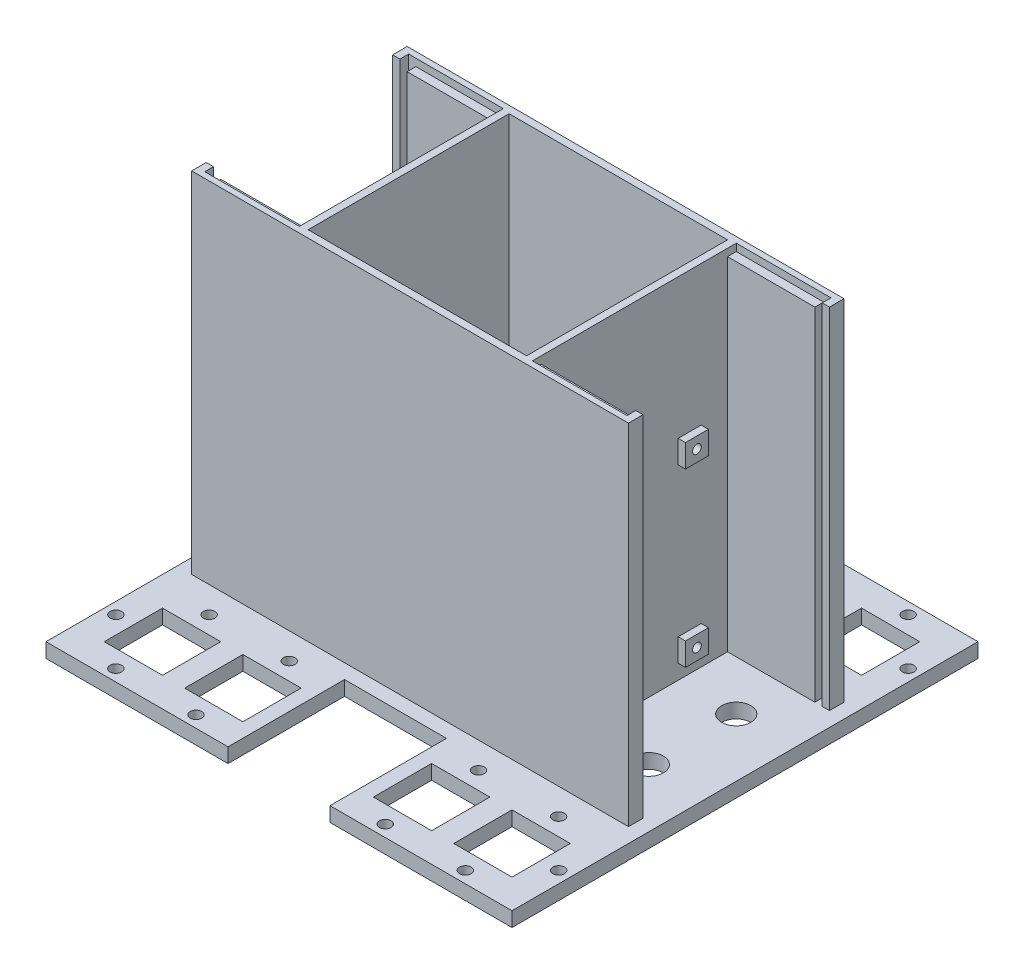
from build123d import *

# Parameters (mm, degrees)
SKETCH1_W               = 203.2
SKETCH1_H               = 203.2
BOSS_EXTRUDE1_DEPTH     = 6.35
SKETCH2_W               = 44.45
SKETCH2_H               = 45.72
SKETCH2_H_2             = 50.8
CUT_EXTRUDE1_DEPTH      = 144.824345992
SKETCH3_R               = 2.54
SKETCH3_W               = 25.4
SKETCH3_H               = 25.4
CUT_EXTRUDE2_DEPTH      = 6.35
MIRROR2_COPY_1_SKETCH_R = 2.54
MIRROR2_COPY_1_SKETCH_W = 25.4
MIRROR2_COPY_1_SKETCH_H = 25.4
MIRROR2_COPY_1_DEPTH    = 6.35
SKETCH4_W               = 101.6
SKETCH4_H               = 93.98
SKETCH4_W_2             = 95.25
SKETCH4_H_2             = 87.63
BOSS_EXTRUDE2_DEPTH     = 152.4
SKETCH5_W               = 10
SKETCH5_H               = 10
SKETCH5_R               = 1.6
BOSS_EXTRUDE3_DEPTH     = 3.175
CUT_EXTRUDE3_REACH      = 246.393
SKETCH8_R               = 1.905
SKETCH9_W               = 6.35
SKETCH9_H               = 152.4
BOSS_EXTRUDE4_DEPTH     = 44.45
SKETCH12_W              = 3.175
SKETCH12_H              = 3.81
CUT_EXTRUDE4_DEPTH      = 152.4
SKETCH13_W              = 38.1
SKETCH13_H              = 3.81
CUT_EXTRUDE5_DEPTH      = 3.175
SKETCH14_W              = 6.35
SKETCH14_H              = 152.4
BOSS_EXTRUDE5_DEPTH     = 44.45
SKETCH15_W              = 3.175
SKETCH15_H              = 3.81
CUT_EXTRUDE6_DEPTH      = 152.4
SKETCH16_W              = 38.1
SKETCH16_H              = 3.81
CUT_EXTRUDE7_DEPTH      = 3.175
CUT_EXTRUDE8_REACH      = 211.454
SKETCH17_R              = 6.35
MIRROR5_OUTLINE_R       = 6.35
MIRROR5_DEPTH           = 6.35


# Read off the part's stored shape, not the designer's step: Mirror5
with BuildPart() as part:
    # Sketch1 → Boss-Extrude1 (new body)
    with BuildSketch(Plane(origin=(0, 0, 0), x_dir=(1, 0, 0), z_dir=(0, 1, 0))):
        Rectangle(SKETCH1_W, SKETCH1_H)
    extrude(amount=BOSS_EXTRUDE1_DEPTH)

    # Sketch2 → Cut-Extrude1 (cut, through all)
    with BuildSketch(Plane(origin=(0, 6.35, 0), x_dir=(1, 0, 0), z_dir=(0, 1, 0))):
        with Locations((0, 78.74)):
            Rectangle(SKETCH2_W, SKETCH2_H)
        with Locations((0, -76.2)):
            Rectangle(SKETCH2_W, SKETCH2_H_2)
    extrude(amount=-CUT_EXTRUDE1_DEPTH, mode=Mode.SUBTRACT)

    # Sketch3 → Cut-Extrude2 (cut)
    with BuildSketch(Plane(origin=(0, 6.35, 0), x_dir=(1, 0, 0), z_dir=(0, 1, 0))):
        with Locations(Location((-96.52, 76.2, 0), (0, 0, 270))):
            Circle(SKETCH3_R)
        with Locations(Location((-76.2, 96.52, 0), (0, 0, 270))):
            Circle(SKETCH3_R)
        with Locations(Location((-76.2, 55.88, 0), (0, 0, 270))):
            Circle(SKETCH3_R)
        with Locations(Location((-41.275, 96.52, 0), (0, 0, 270))):
            Circle(SKETCH3_R)
        with Locations(Location((-41.275, 55.88, 0), (0, 0, 90))):
            Circle(SKETCH3_R)
        with Locations((-41.148, 76.2)):
            Rectangle(SKETCH3_W, SKETCH3_H)
        with Locations((-76.2, 76.2)):
            Rectangle(SKETCH3_W, SKETCH3_H)
    cut_extrude2 = extrude(amount=-CUT_EXTRUDE2_DEPTH, mode=Mode.SUBTRACT)

    # Mirror1: Cut-Extrude2 across plane
    add(cut_extrude2.mirror(Plane(origin=(0, 0, 0), x_dir=(0, 0, 1), z_dir=(1, 0, 0))), mode=Mode.SUBTRACT)

    # Mirror2: Cut-Extrude2 across plane
    add(cut_extrude2.mirror(Plane.XY), mode=Mode.SUBTRACT)

    # Mirror2 copy 1 sketch → Mirror2 copy 1 (cut)
    with BuildSketch(Plane(origin=(0, 6.35, 0), x_dir=(-1, 0, 0), z_dir=(0, 1, 0))):
        with Locations(Location((-96.52, 76.2, 0), (0, 0, 270))):
            Circle(MIRROR2_COPY_1_SKETCH_R)
        with Locations(Location((-76.2, 96.52, 0), (0, 0, 270))):
            Circle(MIRROR2_COPY_1_SKETCH_R)
        with Locations(Location((-76.2, 55.88, 0), (0, 0, 270))):
            Circle(MIRROR2_COPY_1_SKETCH_R)
        with Locations(Location((-41.275, 96.52, 0), (0, 0, 270))):
            Circle(MIRROR2_COPY_1_SKETCH_R)
        with Locations(Location((-41.275, 55.88, 0), (0, 0, 90))):
            Circle(MIRROR2_COPY_1_SKETCH_R)
        with Locations((-41.148, 76.2)):
            Rectangle(MIRROR2_COPY_1_SKETCH_W, MIRROR2_COPY_1_SKETCH_H)
        with Locations((-76.2, 76.2)):
            Rectangle(MIRROR2_COPY_1_SKETCH_W, MIRROR2_COPY_1_SKETCH_H)
    extrude(amount=-MIRROR2_COPY_1_DEPTH, mode=Mode.SUBTRACT)

    # Sketch4 → Boss-Extrude2 (add)
    with BuildSketch(Plane(origin=(0, 6.35, 0), x_dir=(1, 0, 0), z_dir=(0, 1, 0))):
        with Locations((0, 2.54)):
            Rectangle(SKETCH4_W, SKETCH4_H)
        with Locations((0, 2.54)):
            Rectangle(SKETCH4_W_2, SKETCH4_H_2, mode=Mode.SUBTRACT)
    extrude(amount=BOSS_EXTRUDE2_DEPTH)

    # Sketch5 → Boss-Extrude3 (add)
    # profile 1 of 4: a face of its own
    with BuildSketch(Plane(origin=(50.8, 0, 0), x_dir=(0, 0, -1), z_dir=(1, 0, 0))):
        with Locations((-21.59, 93.98)):
            Rectangle(SKETCH5_W, SKETCH5_H)
        with Locations((-21.59, 93.98)):
            Circle(SKETCH5_R, mode=Mode.SUBTRACT)
    # profile 2 of 4: a face of its own
    with BuildSketch(Plane(origin=(50.8, 0, 0), x_dir=(0, 0, -1), z_dir=(1, 0, 0))):
        with Locations((26.67, 92.71)):
            Rectangle(SKETCH5_W, SKETCH5_H)
        with Locations((26.67, 92.71)):
            Circle(SKETCH5_R, mode=Mode.SUBTRACT)
    # profile 3 of 4: a face of its own
    with BuildSketch(Plane(origin=(50.8, 0, 0), x_dir=(0, 0, -1), z_dir=(1, 0, 0))):
        with Locations((-21.59, 11.43)):
            Rectangle(SKETCH5_W, SKETCH5_H)
        with Locations((-21.59, 11.43)):
            Circle(SKETCH5_R, mode=Mode.SUBTRACT)
    # profile 4 of 4: a face of its own
    with BuildSketch(Plane(origin=(50.8, 0, 0), x_dir=(0, 0, -1), z_dir=(1, 0, 0))):
        with Locations((26.67, 17.78)):
            Rectangle(SKETCH5_W, SKETCH5_H)
        with Locations((26.67, 17.78)):
            Circle(SKETCH5_R, mode=Mode.SUBTRACT)
    extrude(amount=BOSS_EXTRUDE3_DEPTH)

    # Sketch8 → Cut-Extrude3 (cut, up to next)
    with BuildSketch(Plane(origin=(53.975, 0, 0), x_dir=(0, 0, -1), z_dir=(1, 0, 0)), mode=Mode.PRIVATE) as cut_extrude3_sk1:
        with Locations((-21.59, 93.98)):
            Circle(SKETCH8_R)
    cut_extrude3_tool1 = extrude(cut_extrude3_sk1.sketch, amount=-CUT_EXTRUDE3_REACH, mode=Mode.PRIVATE) & part.part
    # Sketch8 → Cut-Extrude3 (cut, up to next)
    with BuildSketch(Plane(origin=(53.975, 0, 0), x_dir=(0, 0, -1), z_dir=(1, 0, 0)), mode=Mode.PRIVATE) as cut_extrude3_sk2:
        with Locations((26.67, 92.71)):
            Circle(SKETCH8_R)
    cut_extrude3_tool2 = extrude(cut_extrude3_sk2.sketch, amount=-CUT_EXTRUDE3_REACH, mode=Mode.PRIVATE) & part.part
    # Sketch8 → Cut-Extrude3 (cut, up to next)
    with BuildSketch(Plane(origin=(53.975, 0, 0), x_dir=(0, 0, -1), z_dir=(1, 0, 0)), mode=Mode.PRIVATE) as cut_extrude3_sk3:
        with Locations((-21.59, 11.43)):
            Circle(SKETCH8_R)
    cut_extrude3_tool3 = extrude(cut_extrude3_sk3.sketch, amount=-CUT_EXTRUDE3_REACH, mode=Mode.PRIVATE) & part.part
    # Sketch8 → Cut-Extrude3 (cut, up to next)
    with BuildSketch(Plane(origin=(53.975, 0, 0), x_dir=(0, 0, -1), z_dir=(1, 0, 0)), mode=Mode.PRIVATE) as cut_extrude3_sk4:
        with Locations((26.67, 17.78)):
            Circle(SKETCH8_R)
    cut_extrude3_tool4 = extrude(cut_extrude3_sk4.sketch, amount=-CUT_EXTRUDE3_REACH, mode=Mode.PRIVATE) & part.part
    add(cut_extrude3_tool1.solids().sort_by_distance((53.975, 93.98, 21.59))[0], mode=Mode.SUBTRACT)
    add(cut_extrude3_tool2.solids().sort_by_distance((53.975, 92.71, -26.67))[0], mode=Mode.SUBTRACT)
    add(cut_extrude3_tool3.solids().sort_by_distance((53.975, 11.43, 21.59))[0], mode=Mode.SUBTRACT)
    add(cut_extrude3_tool4.solids().sort_by_distance((53.975, 17.78, -26.67))[0], mode=Mode.SUBTRACT)

    # Sketch9 → Boss-Extrude4 (add)
    with BuildSketch(Plane(origin=(50.8, 0, 0), x_dir=(0, 0, -1), z_dir=(1, 0, 0))):
        with Locations((-41.275, 82.55)):
            Rectangle(SKETCH9_W, SKETCH9_H)
        with Locations((46.355, 82.55)):
            Rectangle(SKETCH9_W, SKETCH9_H)
    extrude(amount=BOSS_EXTRUDE4_DEPTH)

    # Sketch12 → Cut-Extrude4 (cut)
    with BuildSketch(Plane(origin=(0, 158.75, 0), x_dir=(1, 0, 0), z_dir=(0, 1, 0))):
        with Locations((90.4875, -40.005)):
            Rectangle(SKETCH12_W, SKETCH12_H)
    cut_extrude4 = extrude(amount=-CUT_EXTRUDE4_DEPTH, mode=Mode.SUBTRACT)

    # Sketch13 → Cut-Extrude5 (cut)
    with BuildSketch(Plane(origin=(0, 158.75, 0), x_dir=(1, 0, 0), z_dir=(0, 1, 0))):
        with Locations((69.85, -40.005)):
            Rectangle(SKETCH13_W, SKETCH13_H)
    cut_extrude5 = extrude(amount=-CUT_EXTRUDE5_DEPTH, mode=Mode.SUBTRACT)

    # Mirror3: Cut-Extrude4, Cut-Extrude5 across plane
    add(cut_extrude4.mirror(Plane(origin=(0, 0, -2.54), x_dir=(1, 0, 0), z_dir=(0, 0, -1))), mode=Mode.SUBTRACT)
    add(cut_extrude5.mirror(Plane(origin=(0, 0, -2.54), x_dir=(1, 0, 0), z_dir=(0, 0, -1))), mode=Mode.SUBTRACT)

    # Sketch14 → Boss-Extrude5 (add)
    with BuildSketch(Plane.ZY.offset(50.8)):
        with Locations((-46.355, 82.55)):
            Rectangle(SKETCH14_W, SKETCH14_H)
        with Locations((41.275, 82.55)):
            Rectangle(SKETCH14_W, SKETCH14_H)
    extrude(amount=BOSS_EXTRUDE5_DEPTH)

    # Sketch15 → Cut-Extrude6 (cut)
    with BuildSketch(Plane(origin=(0, 158.75, 0), x_dir=(1, 0, 0), z_dir=(0, 1, 0))):
        with Locations((-90.4875, -40.005)):
            Rectangle(SKETCH15_W, SKETCH15_H)
    cut_extrude6 = extrude(amount=-CUT_EXTRUDE6_DEPTH, mode=Mode.SUBTRACT)

    # Sketch16 → Cut-Extrude7 (cut)
    with BuildSketch(Plane(origin=(0, 158.75, 0), x_dir=(1, 0, 0), z_dir=(0, 1, 0))):
        with Locations((-69.85, -40.005)):
            Rectangle(SKETCH16_W, SKETCH16_H)
    cut_extrude7 = extrude(amount=-CUT_EXTRUDE7_DEPTH, mode=Mode.SUBTRACT)

    # Mirror4: Cut-Extrude6, Cut-Extrude7 across plane
    add(cut_extrude6.mirror(Plane(origin=(0, 0, -2.54), x_dir=(1, 0, 0), z_dir=(0, 0, -1))), mode=Mode.SUBTRACT)
    add(cut_extrude7.mirror(Plane(origin=(0, 0, -2.54), x_dir=(1, 0, 0), z_dir=(0, 0, -1))), mode=Mode.SUBTRACT)

    # Sketch17 → Cut-Extrude8 (cut, up to next)
    with BuildSketch(Plane(origin=(0, 6.35, 0), x_dir=(1, 0, 0), z_dir=(0, 1, 0)), mode=Mode.PRIVATE) as cut_extrude8_sk1:
        with Locations(Location((-76.2, -16.51, 0), (0, 0, 270))):
            Circle(SKETCH17_R)
    cut_extrude8_tool1 = extrude(cut_extrude8_sk1.sketch, amount=-CUT_EXTRUDE8_REACH, mode=Mode.PRIVATE) & part.part
    # Sketch17 → Cut-Extrude8 (cut, up to next)
    with BuildSketch(Plane(origin=(0, 6.35, 0), x_dir=(1, 0, 0), z_dir=(0, 1, 0)), mode=Mode.PRIVATE) as cut_extrude8_sk2:
        with Locations(Location((-76.2, 21.59, 0), (0, 0, 90))):
            Circle(SKETCH17_R)
    cut_extrude8_tool2 = extrude(cut_extrude8_sk2.sketch, amount=-CUT_EXTRUDE8_REACH, mode=Mode.PRIVATE) & part.part
    # Sketch17 → Cut-Extrude8 (cut, up to next)
    with BuildSketch(Plane(origin=(0, 6.35, 0), x_dir=(1, 0, 0), z_dir=(0, 1, 0)), mode=Mode.PRIVATE) as cut_extrude8_sk3:
        with Locations(Location((-28.575, 27.305, 0), (0, 0, 270))):
            Circle(SKETCH17_R)
    cut_extrude8_tool3 = extrude(cut_extrude8_sk3.sketch, amount=-CUT_EXTRUDE8_REACH, mode=Mode.PRIVATE) & part.part
    # Sketch17 → Cut-Extrude8 (cut, up to next)
    with BuildSketch(Plane(origin=(0, 6.35, 0), x_dir=(1, 0, 0), z_dir=(0, 1, 0)), mode=Mode.PRIVATE) as cut_extrude8_sk4:
        with Locations(Location((28.575, -22.225, 0), (0, 0, 270))):
            Circle(SKETCH17_R)
    cut_extrude8_tool4 = extrude(cut_extrude8_sk4.sketch, amount=-CUT_EXTRUDE8_REACH, mode=Mode.PRIVATE) & part.part
    add(cut_extrude8_tool1.solids().sort_by_distance((-76.2, 6.35, 16.51))[0], mode=Mode.SUBTRACT)
    add(cut_extrude8_tool2.solids().sort_by_distance((-76.2, 6.35, -21.59))[0], mode=Mode.SUBTRACT)
    add(cut_extrude8_tool3.solids().sort_by_distance((-28.575, 6.35, -27.305))[0], mode=Mode.SUBTRACT)
    add(cut_extrude8_tool4.solids().sort_by_distance((28.575, 6.35, 22.225))[0], mode=Mode.SUBTRACT)

    # Mirror5 outline → Mirror5 (cut)
    with BuildSketch(Plane(origin=(0, 0, 0), x_dir=(1, 0, 0), z_dir=(0, 1, 0))):
        with Locations((76.2, 21.59)):
            Circle(MIRROR5_OUTLINE_R)
        with Locations((76.2, -16.51)):
            Circle(MIRROR5_OUTLINE_R)
    extrude(amount=MIRROR5_DEPTH, mode=Mode.SUBTRACT)


solid = part.part
